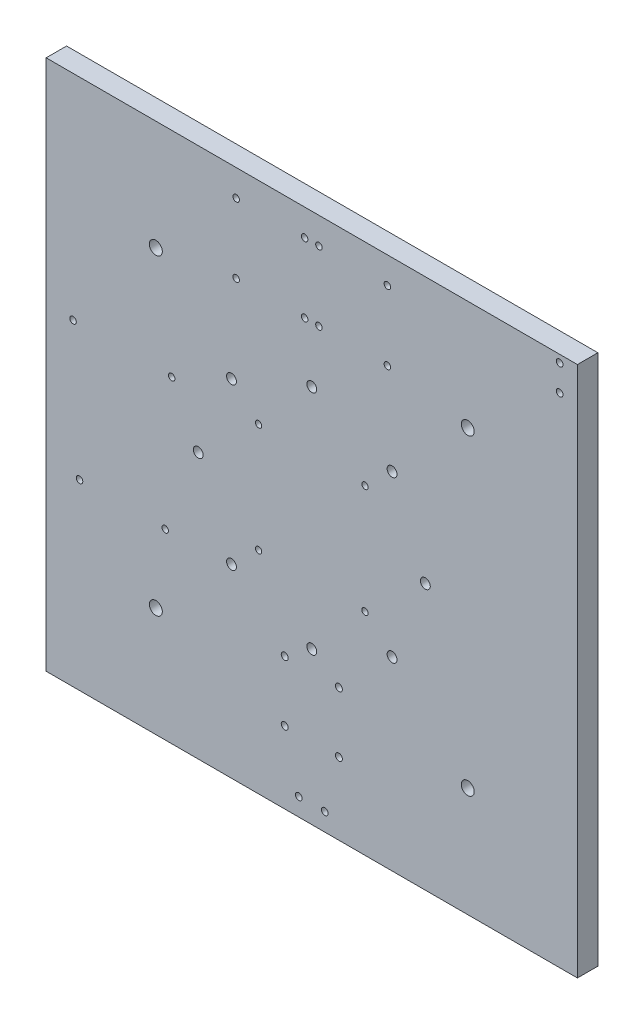
from build123d import *

# Parameters (mm, degrees)
SKETCH1_W           = 260
SKETCH1_H           = 260
SKETCH1_R           = 1.55
SKETCH1_R_2         = 1.5875
SKETCH1_R_3         = 1.6
SKETCH1_R_4         = 1.7
SKETCH1_R_5         = 3.175
SKETCH1_R_6         = 2.415
SKETCH1_R_7         = 1.651
BOSS_EXTRUDE2_DEPTH = 10


with BuildPart() as part:
    # Sketch1 → Boss-Extrude2 (new body)
    with BuildSketch(Plane.XY):
        Rectangle(SKETCH1_W, SKETCH1_H)
        with Locations((-26.035, 26.67)):
            Circle(SKETCH1_R, mode=Mode.SUBTRACT)
        with Locations((-26.035, -26.67)):
            Circle(SKETCH1_R, mode=Mode.SUBTRACT)
        with Locations((26.035, 26.67)):
            Circle(SKETCH1_R, mode=Mode.SUBTRACT)
        with Locations((26.035, -26.67)):
            Circle(SKETCH1_R, mode=Mode.SUBTRACT)
        with Locations((-116.825, 25.402702903)):
            Circle(SKETCH1_R_2, mode=Mode.SUBTRACT)
        with Locations((-113.65, -40.635194695)):
            Circle(SKETCH1_R_2, mode=Mode.SUBTRACT)
        with Locations((-68.565, 25.404805305)):
            Circle(SKETCH1_R_2, mode=Mode.SUBTRACT)
        with Locations((-37, 117)):
            Circle(SKETCH1_R_3, mode=Mode.SUBTRACT)
        with Locations((-37, 83)):
            Circle(SKETCH1_R_3, mode=Mode.SUBTRACT)
        with Locations((-3.5, 117)):
            Circle(SKETCH1_R_3, mode=Mode.SUBTRACT)
        with Locations((-3.5, 83)):
            Circle(SKETCH1_R_3, mode=Mode.SUBTRACT)
        with Locations((3.5, 117)):
            Circle(SKETCH1_R_3, mode=Mode.SUBTRACT)
        with Locations((37, 117)):
            Circle(SKETCH1_R_3, mode=Mode.SUBTRACT)
        with Locations((37, 83)):
            Circle(SKETCH1_R_3, mode=Mode.SUBTRACT)
        with Locations((3.5, 83)):
            Circle(SKETCH1_R_3, mode=Mode.SUBTRACT)
        with Locations((-13.25, -65.25)):
            Circle(SKETCH1_R_4, mode=Mode.SUBTRACT)
        with Locations((13.25, -65.25)):
            Circle(SKETCH1_R_4, mode=Mode.SUBTRACT)
        with Locations((13.25, -94.75)):
            Circle(SKETCH1_R_4, mode=Mode.SUBTRACT)
        with Locations((-13.25, -94.75)):
            Circle(SKETCH1_R_4, mode=Mode.SUBTRACT)
        with Locations((-76.33, 76.33)):
            Circle(SKETCH1_R_5, mode=Mode.SUBTRACT)
        with Locations((0, 55.575)):
            Circle(SKETCH1_R_6, mode=Mode.SUBTRACT)
        with Locations((-55.575, 0)):
            Circle(SKETCH1_R_6, mode=Mode.SUBTRACT)
        with Locations((0, -55.575)):
            Circle(SKETCH1_R_6, mode=Mode.SUBTRACT)
        with Locations((55.575, 0)):
            Circle(SKETCH1_R_6, mode=Mode.SUBTRACT)
        with Locations((-39.297459364, 39.297459364)):
            Circle(SKETCH1_R_6, mode=Mode.SUBTRACT)
        with Locations((39.297459364, 39.297459364)):
            Circle(SKETCH1_R_6, mode=Mode.SUBTRACT)
        with Locations((39.297459364, -39.297459364)):
            Circle(SKETCH1_R_6, mode=Mode.SUBTRACT)
        with Locations((-39.297459364, -39.297459364)):
            Circle(SKETCH1_R_6, mode=Mode.SUBTRACT)
        with Locations((76.33, 76.33)):
            Circle(SKETCH1_R_5, mode=Mode.SUBTRACT)
        with Locations((76.33, -76.33)):
            Circle(SKETCH1_R_5, mode=Mode.SUBTRACT)
        with Locations((-76.33, -76.33)):
            Circle(SKETCH1_R_5, mode=Mode.SUBTRACT)
        with Locations((-71.74, -40.635194695)):
            Circle(SKETCH1_R_2, mode=Mode.SUBTRACT)
        with Locations((6.35, -121.3)):
            Circle(SKETCH1_R_7, mode=Mode.SUBTRACT)
        with Locations((-6.35, -121.3)):
            Circle(SKETCH1_R_7, mode=Mode.SUBTRACT)
        with Locations((121.3, 126.35)):
            Circle(SKETCH1_R_7, mode=Mode.SUBTRACT)
        with Locations((121.3, 113.65)):
            Circle(SKETCH1_R_7, mode=Mode.SUBTRACT)
    extrude(amount=BOSS_EXTRUDE2_DEPTH)


solid = part.part
